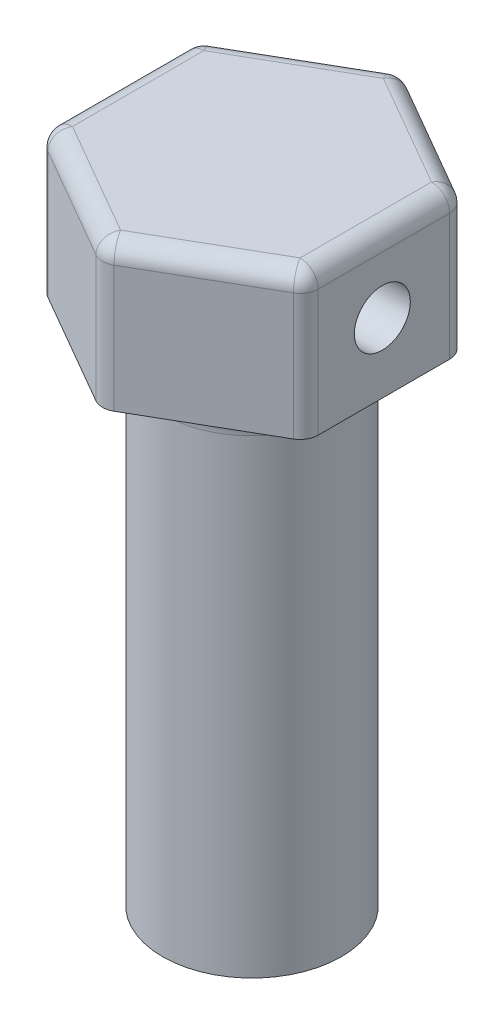
from build123d import *

# Parameters (mm, degrees)
BOSS_EXTRUDE1_DEPTH = 8
SKETCH2_R           = 4.95
BOSS_EXTRUDE2_DEPTH = 28
FILLET1_R           = 2
SKETCH3_R           = 1.55
CUT_EXTRUDE1_DEPTH  = 33.683533061
FILLET2_R           = 1
CUT_EXTRUDE3_START  = -4
SKETCH5_R           = 1.55
CUT_EXTRUDE3_DEPTH  = 4


with BuildPart() as part:
    # Sketch1 → Boss-Extrude1 (new body)
    with BuildSketch(Plane(origin=(0, 0, 0), x_dir=(1, 0, 0), z_dir=(0, 1, 0))):
        Polygon((7.3, -4.214656965), (7.3, 4.214656965), (0, 8.42931393), (-7.3, 4.214656965), (-7.3, -4.214656965), (0, -8.42931393), align=None)
    extrude(amount=BOSS_EXTRUDE1_DEPTH)

    # Sketch2 → Boss-Extrude2 (add)
    with BuildSketch(Plane.XZ):
        Circle(SKETCH2_R)
        with BuildLine():
            Line((-1.15, 1.039230485), (-1.15, -1.039230485))
            ThreePointArc((-1.15, -1.039230485), (1.55, 0), (-1.15, 1.039230485))
        make_face(mode=Mode.SUBTRACT)
    extrude(amount=BOSS_EXTRUDE2_DEPTH)

    # Fillet1
    fillet1_edges = [part.edges().sort_by_distance(p)[0] for p in [
        (-4.95, 0, 0),
    ]]
    fillet(fillet1_edges, radius=FILLET1_R)

    # Sketch3 → Cut-Extrude1 (cut, through all)
    with BuildSketch(Plane(origin=(7.3, 0, 0), x_dir=(0, 0, -1), z_dir=(1, 0, 0))):
        with Locations((-0.085343035, 3.85)):
            Circle(SKETCH3_R)
    extrude(amount=-CUT_EXTRUDE1_DEPTH, mode=Mode.SUBTRACT)

    # Fillet2
    fillet2_edges = [part.edges().sort_by_distance(p)[0] for p in [
        (-3.65, 8, 6.321985448),
        (-7.3, 8, 0),
        (-3.65, 8, -6.321985448),
        (3.65, 8, -6.321985448),
        (7.3, 8, 0),
        (3.65, 8, 6.321985448),
        (-7.3, 4, -4.214656965),
        (0, 4, -8.42931393),
        (7.3, 4, -4.214656965),
        (7.3, 4, 4.214656965),
        (0, 4, 8.42931393),
        (-7.3, 4, 4.214656965),
    ]]
    fillet(fillet2_edges, radius=FILLET2_R)

    # Sketch5 → Cut-Extrude3 (cut)
    with BuildSketch(Plane.XZ.offset(28).offset(CUT_EXTRUDE3_START)):
        Circle(SKETCH5_R)
    extrude(amount=CUT_EXTRUDE3_DEPTH, mode=Mode.SUBTRACT)


solid = part.part
